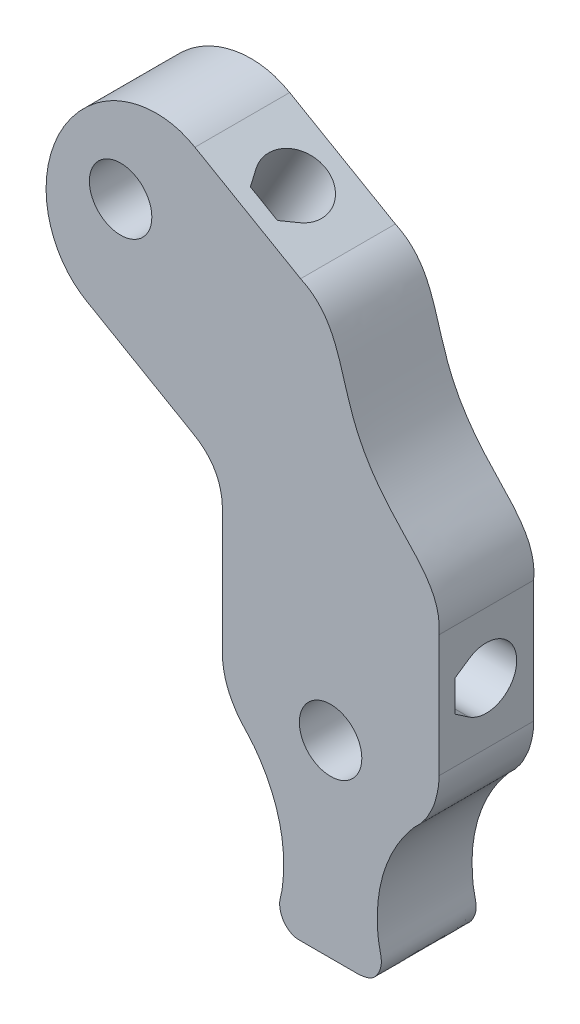
from build123d import *

# Parameters (mm, degrees)
MODEL_R               = 4.350000706
MODEL_R_2             = 4.349999799
MAIN_BODY_DEPTH       = 13.2
SIDE_UP_GRAPHIC_DEPTH = 1
HOLE_1_REACH          = 105.138
HOLE_2_REACH          = 92.65
FEET_START            = -13.2
FEET_DEPTH            = 13.2
FEET_2_DEPTH          = 13.2


with BuildPart() as part:
    # Model → Main body (new body)
    with BuildSketch(Plane.XY):
        with BuildLine():
            Line((-32.385716927, 85.015037266), (-17.664212376, 76.51580568))
            add(Edge.make_bspline(
                [(-17.664212376, 76.51580568), (-13.888667637, 74.796323916), (-12.180877949, 69.346014711), (-10.138675946, 62.322650769), (-7.341972498, 57.370319376), (-2.311164681, 51.709551955), (2.051635964, 47.586422851), (1.587639106, 43.172213575)],
                knots=[0, 0, 0, 0, 0.279424532, 0.419811254, 0.560236706, 0.707309635, 1, 1, 1, 1], degree=3))
            Line((1.587639106, 43.172213575), (1.587638631, 26.172213575))
            add(Edge.make_bspline(
                [(1.587638631, 26.172213575), (1.626935513, 22.433749487), (-1.504300665, 17.452795295), (-8.065829548, 14.211603151), (-13.487361838, 13.402379484), (-18.908893689, 14.211603727), (-25.470424367, 17.452793212), (-28.601657646, 22.43375075), (-28.56236242, 26.172213575)],
                knots=[0, 0, 0, 0, 0.249525848, 0.374711548, 0.499999996, 0.625288445, 0.750474147, 1, 1, 1, 1], degree=3))
            Line((-28.56236242, 26.172213575), (-28.56236242, 43.172213575))
            add(Edge.make_bspline(
                [(-32.738896605, 50.404970807), (-28.545329723, 48.088642942), (-28.56236242, 43.172213575)],
                knots=[0, 0, 0, 1, 1, 1], degree=2))
            Line((-32.738896605, 50.404970807), (-47.460401156, 58.904202393))
            add(Edge.make_bspline(
                [(-32.385716927, 85.015037266), (-35.600482561, 86.916604127), (-41.47416026, 86.698262272), (-47.559385173, 82.644559832), (-50.972093499, 78.360729606), (-52.985252535, 73.268130297), (-53.475716234, 65.959753317), (-50.709975768, 60.754328328), (-47.460401156, 58.904202393)],
                knots=[0, 0, 0, 0, 0.249330305, 0.374421877, 0.499616194, 0.624810444, 0.749903309, 1, 1, 1, 1], degree=3))
        make_face()
        with Locations((-13.487362418, 22.922213336)):
            Circle(MODEL_R, mode=Mode.SUBTRACT)
        with Locations((-42.737362401, 73.584699743)):
            Circle(MODEL_R_2, mode=Mode.SUBTRACT)
    extrude(amount=MAIN_BODY_DEPTH)

    # Model<4> → Side up graphic (cut)
    with BuildSketch(Plane.XY):
        Polygon((-12.838506986, 49.041740594), (-15.538506025, 49.04174176), (-15.538506908, 58.441741757), (-18.138507369, 58.441742904), (-14.138506535, 63.841741707), (-10.238506525, 58.441741095), (-12.838506986, 58.441742242), align=None)
        Polygon((-21.338505039, 58.441741118), (-21.338505039, 49.04173947), (-24.138505889, 49.041742563), (-24.138507726, 58.441740908), (-26.638506376, 58.441740128), (-22.63850624, 63.841741536), (-18.738507881, 58.441741879), align=None)
        Polygon((-26.238505906, 48.541742051), (-10.538506028, 48.54174036), (-10.538507195, 45.841741392), (-26.238507072, 45.841743083), align=None)
    extrude(amount=SIDE_UP_GRAPHIC_DEPTH, mode=Mode.SUBTRACT)

    # Schizzo10 → Hole 1 (cut, up to next)
    with BuildSketch(Plane(origin=(1.587637901, -4.4e-08, 0), x_dir=(0, 0, -1), z_dir=(0.9999999999999997, -2.789602577989315e-08, 0)), mode=Mode.PRIVATE) as hole_1_sk1:
        with BuildLine():
            Line((-10.95, 36.847213619), (-10.95, 32.497213619))
            Line((-10.95, 32.497213619), (-8.99780105, 31.163218019))
            ThreePointArc((-8.99780105, 31.163218019), (-2.35, 34.672213619), (-8.99780105, 38.181209219))
            Line((-8.99780105, 38.181209219), (-10.95, 36.847213619))
        make_face()
    hole_1_tool1 = extrude(hole_1_sk1.sketch, amount=-HOLE_1_REACH, mode=Mode.PRIVATE) & part.part
    add(hole_1_tool1.solids().sort_by_distance((1.587639, 34.672214, 6.73262))[0], mode=Mode.SUBTRACT)

    # Schizzo4 → Hole 2 (cut, up to next)
    with BuildSketch(Plane(origin=(28.715990067, 49.738917475, 0), x_dir=(0.8660313397108585, -0.499989718532907, 0), z_dir=(0.49998971853290697, 0.8660313397108584, 0)), mode=Mode.PRIVATE) as hole_2_sk1:
        with BuildLine():
            Line((-64.229284013, -10.95), (-59.879284013, -10.95))
            Line((-59.879284013, -10.95), (-58.545288413, -8.99780105))
            ThreePointArc((-58.545288413, -8.99780105), (-62.054284013, -2.35), (-65.563279613, -8.99780105))
            Line((-65.563279613, -8.99780105), (-64.229284013, -10.95))
        make_face()
    hole_2_tool1 = extrude(hole_2_sk1.sketch, amount=-HOLE_2_REACH, mode=Mode.PRIVATE) & part.part
    add(hole_2_tool1.solids().sort_by_distance((-25.024965, 80.765421, 6.73262))[0], mode=Mode.SUBTRACT)

    # Feet: read off the stored shape, not the designer's step
    # Feet outline → Feet (cut)
    with BuildSketch(Plane(origin=(0, 0, 0), x_dir=(-1, 0, 0), z_dir=(0, 0, -1)).offset(FEET_START)):
        with BuildLine():
            add(Edge.make_bspline(
                [(1.617445379, 18.475244195), (1.672241669, 18.422198484), (1.785443968, 18.310894344), (1.887324487, 18.202102285), (1.937328657, 18.146571293)],
                knots=[0.404989306, 0.404989306, 0.404989306, 0.404989306, 0.41039569, 0.416114241, 0.416114241, 0.416114241, 0.416114241], degree=3))
            add(Edge.make_bspline(
                [(1.617445379, 18.475244195), (1.722186479, 18.363918972), (1.828847726, 18.254343492), (1.937328657, 18.146571293)],
                knots=[0.196373675, 0.196373675, 0.196373675, 0.196373675, 0.206915239, 0.206915239, 0.206915239, 0.206915239], degree=3))
        make_face()
    extrude(amount=FEET_DEPTH, mode=Mode.SUBTRACT)

    # Feet 2 outline → Feet 2 (add)
    with BuildSketch(Plane(origin=(0, 0, 0), x_dir=(-1, 0, 0), z_dir=(0, 0, -1)).offset(FEET_START)):
        with BuildLine():
            add(Edge.make_bspline(
                [(-1.587638631, 26.172213575), (-1.618564778, 23.230089788), (-0.333725787, 20.549067776), (1.617445379, 18.475244195)],
                knots=[0, 0, 0, 0, 0.196373675, 0.196373675, 0.196373675, 0.196373675], degree=3))
            add(Edge.make_bspline(
                [(-1.587638631, 26.172213575), (-1.645799355, 25.352500299), (-1.370238761, 23.819193134), (-0.946380651, 22.322919054), (-0.335935677, 21.089168209), (0.039703043, 20.293595206), (0.786411785, 19.368229132), (0.91004105, 19.147407329), (1.546377013, 18.544042136), (1.617445379, 18.475244195)],
                knots=[0, 0, 0, 0, 0.121722264, 0.21246548, 0.234914634, 0.323764652, 0.341882744, 0.397977466, 0.404989306, 0.404989306, 0.404989306, 0.404989306], degree=3))
        make_face()
        with BuildLine():
            add(Edge.make_bspline(
                [(1.937328657, 18.146571293), (2.375825142, 17.710939612), (4.219661314, 16.111491194), (8.065829548, 14.211603151), (13.487361838, 13.402379484), (18.908893689, 14.211603727), (25.470424367, 17.452793212), (28.601657646, 22.43375075), (28.56236242, 26.172213575)],
                knots=[0.206915239, 0.206915239, 0.206915239, 0.206915239, 0.249525848, 0.374711548, 0.499999996, 0.625288445, 0.750474147, 1, 1, 1, 1], degree=3))
            add(Edge.make_bspline(
                [(1.937328657, 18.146571293), (2.265520543, 17.782105276), (2.58140699, 17.296879402), (3.794212722, 15.716220402), (4.820081692, 13.956885051), (5.810743144, 11.622003526), (6.39838083, 9.71468034), (6.793742924, 7.757133834), (6.994917172, 5.769303348), (6.982786394, 3.77453563), (6.84327878, 1.950183425), (6.48868216, 0.611023112), (6.338003308, -0.718293148), (6.905671081, -2.22430068), (7.917465645, -3.162516612), (9.419577102, -3.364915886), (9.465600294, -3.358418073)],
                knots=[0.416114241, 0.416114241, 0.416114241, 0.416114241, 0.453646757, 0.468506229, 0.553584024, 0.600937777, 0.648267117, 0.695592694, 0.742926149, 0.790263012, 0.837596467, 0.872691441, 0.888628807, 0.932636917, 0.976655261, 1, 1, 1, 1], degree=3))
            Line((9.465600294, -3.358418073), (17.592429859, -3.358418073))
            add(Edge.make_bspline(
                [(17.592429859, -3.358418073), (17.94710254, -3.361430129), (18.797097581, -3.339559885), (20.198227234, -2.290802404), (20.635216776, -0.823269702), (20.559713647, 0.184341362), (20.257398386, 1.191800118), (20.093724678, 2.681192511), (19.973919557, 4.670898735), (20.07803062, 6.666873348), (20.375555805, 8.641186349), (20.868893223, 10.57675976), (21.550372192, 12.453727407), (22.416941828, 14.253829078), (23.464728705, 15.951593879), (24.501456748, 17.375225201), (25.619319286, 18.495142101), (26.680160389, 19.804854398), (27.66821034, 21.497688321), (28.40075896, 23.671611828), (28.573115245, 25.178668256), (28.56236242, 26.172213575)],
                knots=[0, 0, 0, 0, 0.027659547, 0.083336738, 0.139000984, 0.159159574, 0.173630483, 0.233516851, 0.293375319, 0.353233787, 0.413120141, 0.47298465, 0.532856344, 0.592727518, 0.652578769, 0.712466068, 0.750774856, 0.79493166, 0.863998409, 0.926146295, 1, 1, 1, 1], degree=3))
        make_face()
    extrude(amount=FEET_2_DEPTH)


solid = part.part
